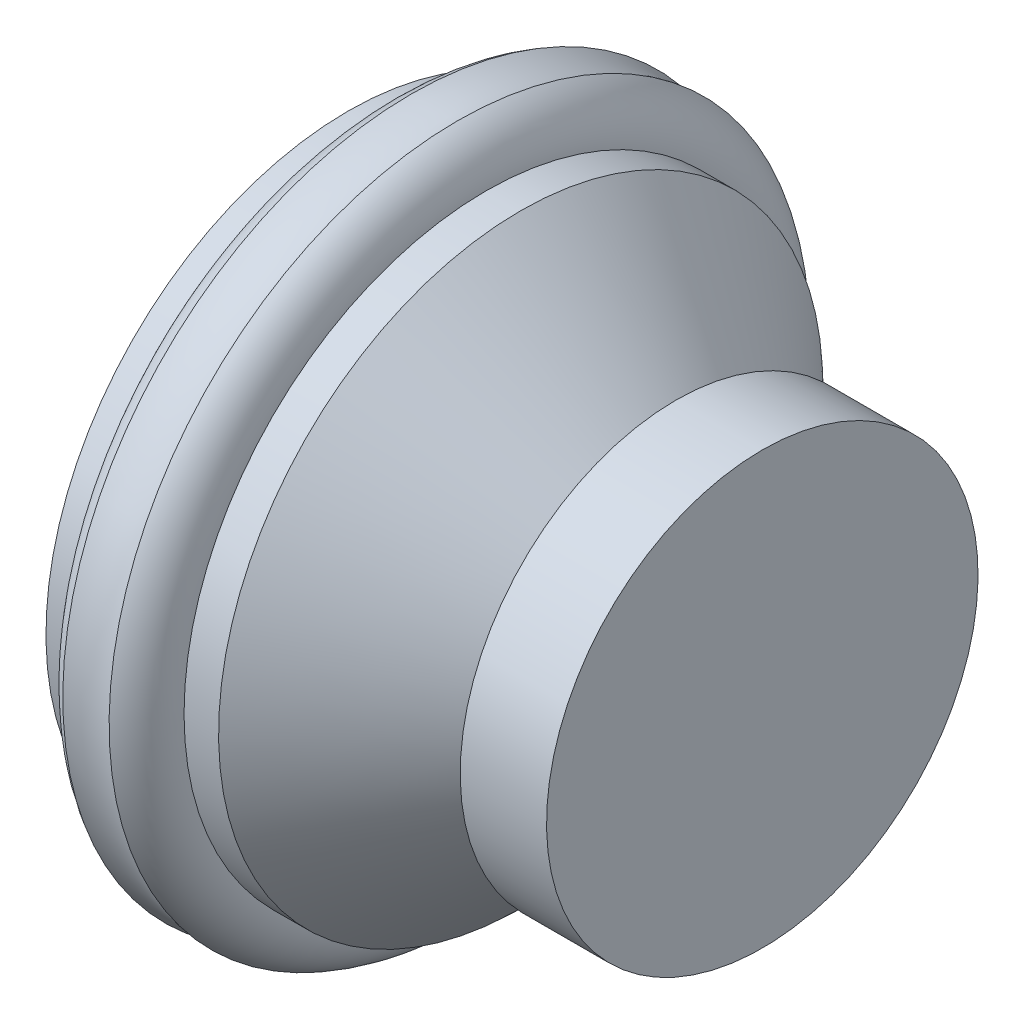
from build123d import *


with BuildPart() as part:
    # Sketch1 → Revolve2 (revolve)
    with BuildSketch(Plane.XY):
        Polygon((-133, 17.5), (-143, 17.5), (-143, 0), (-119, 0), (-119, 12.5), (-124, 12.5), (-124, 9), align=None)
    revolve(axis=Axis((-119, 0, 0), (-1, 0, 0)))

    # Sketch2 → Revolve3 (revolve)
    with BuildSketch(Plane.XY):
        with BuildLine():
            Line((-141, 17.5), (-135, 17.5))
            ThreePointArc((-135, 17.5), (-135.448078001, 19.077242565), (-136.658462739, 20.183333333))
            ThreePointArc((-136.658462739, 20.183333333), (-138, 20), (-139.341537261, 20.183333333))
            ThreePointArc((-139.341537261, 20.183333333), (-140.551921999, 19.077242565), (-141, 17.5))
        make_face()
    revolve(axis=Axis((-119, 0, 0), (-1, 0, 0)))


solid = part.part
